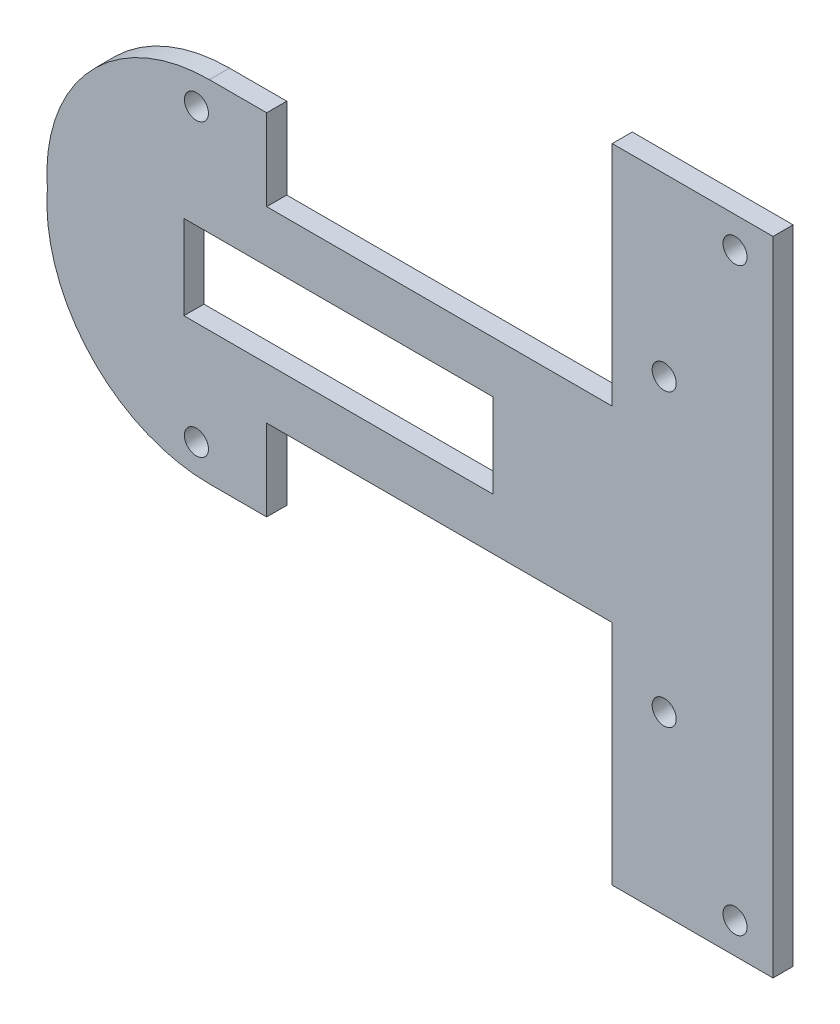
from build123d import *

# Parameters (mm, degrees)
ESQUISSE1_R             = 3
BOSS_EXTRU_2_DEPTH      = 5
ESQUISSE2_W             = 77
ESQUISSE2_H             = 21
ENL_V_MAT_EXTRU_2_DEPTH = 5


with BuildPart() as part:
    # Esquisse1 → Boss.-Extru.2 (new body)
    with BuildSketch(Plane.XY):
        with BuildLine():
            Line((0, 80), (-40.063357395, 80))
            Line((-40.063357395, 80), (-40.063357395, 43.608028339))
            Line((-40.063357395, 43.608028339), (-40.063357395, 23.347203835))
            Line((-40.063357395, 23.347203835), (-126.14466041, 23.347203835))
            Line((-126.14466041, 23.347203835), (-126.14466041, 43.608028339))
            Line((-126.14466041, 43.608028339), (-140.404811956, 43.608028339))
            ThreePointArc((-140.404811956, 43.608028339), (-170.122450923, 30.625328971), (-180.789117416, 0))
            ThreePointArc((-180.789117416, 0), (-170.122450923, -30.625328971), (-140.404811956, -43.608028339))
            Line((-140.404811956, -43.608028339), (-126.14466041, -43.608028339))
            Line((-126.14466041, -43.608028339), (-126.14466041, -23.347203835))
            Line((-126.14466041, -23.347203835), (-40.063357395, -23.347203835))
            Line((-40.063357395, -23.347203835), (-40.063357395, -43.608028339))
            Line((-40.063357395, -43.608028339), (-40.063357395, -80))
            Line((-40.063357395, -80), (0, -80))
            Line((0, -80), (0, 80))
        make_face()
        with Locations((-143.652955215, 36.206579824)):
            Circle(ESQUISSE1_R, mode=Mode.SUBTRACT)
        with Locations((-27.113068306, 36.206579824)):
            Circle(ESQUISSE1_R, mode=Mode.SUBTRACT)
        with Locations((-9.467128793, 72.29182392)):
            Circle(ESQUISSE1_R, mode=Mode.SUBTRACT)
        with Locations((-9.467128793, -72.29182392)):
            Circle(ESQUISSE1_R, mode=Mode.SUBTRACT)
        with Locations((-27.113068306, -36.206579824)):
            Circle(ESQUISSE1_R, mode=Mode.SUBTRACT)
        with Locations((-143.652955215, -36.206579824)):
            Circle(ESQUISSE1_R, mode=Mode.SUBTRACT)
    extrude(amount=BOSS_EXTRU_2_DEPTH)

    # Esquisse2 → Enlèv. mat.-Extru.2 (cut)
    with BuildSketch(Plane.XY.offset(5)):
        with Locations((-108.276795965, 0)):
            Rectangle(ESQUISSE2_W, ESQUISSE2_H)
    extrude(amount=-ENL_V_MAT_EXTRU_2_DEPTH, mode=Mode.SUBTRACT)


solid = part.part
